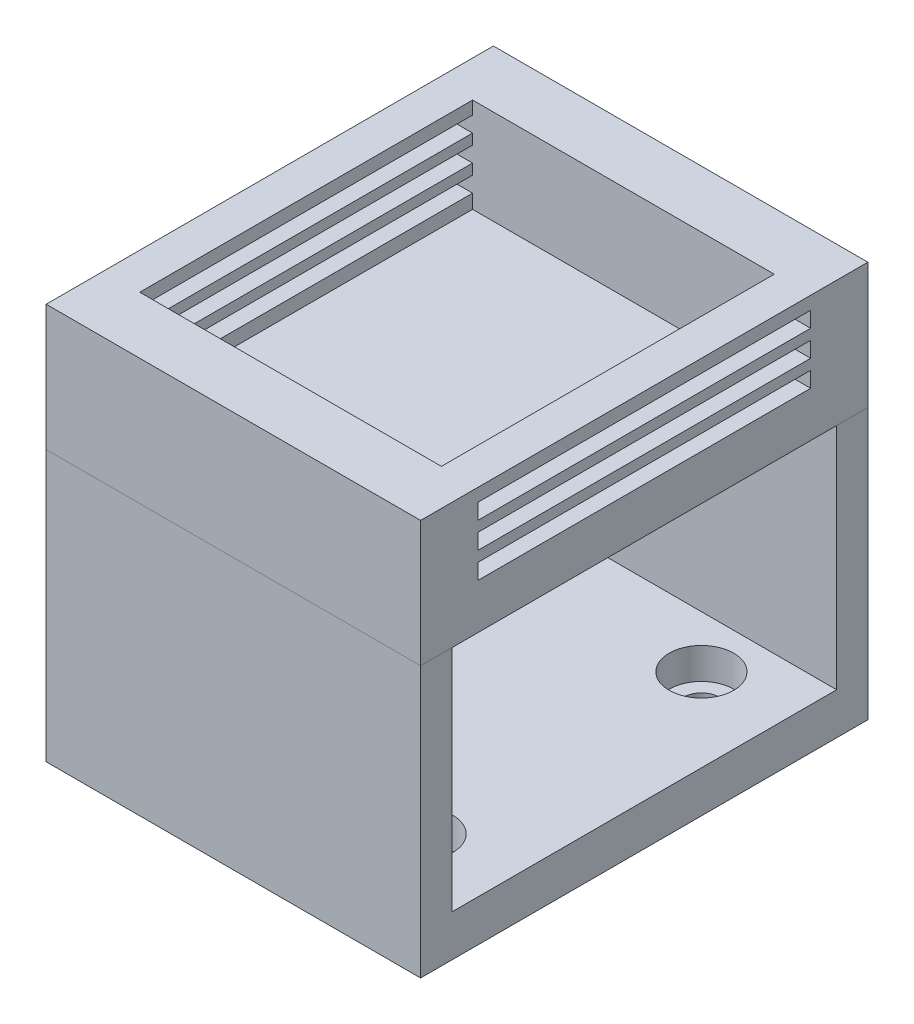
from build123d import *

# Parameters (mm, degrees)
CROQUIS1_W                 = 36
CROQUIS1_H                 = 43
SALIENTE_EXTRUIR4_DEPTH    = 4
CROQUIS6_W                 = 36
CROQUIS6_H                 = 3
SALIENTE_EXTRUIR5_DEPTH    = 22
CROQUIS7_W                 = 36
CROQUIS7_H                 = 43
SALIENTE_EXTRUIR6_DEPTH    = 3
CROQUIS8_W                 = 3
CROQUIS8_H                 = 43
SALIENTE_EXTRUIR7_DEPTH    = 4
CROQUIS9_W                 = 36
CROQUIS9_H                 = 43
CROQUIS9_W_2               = 29
CROQUIS9_H_2               = 32
SALIENTE_EXTRUIR8_DEPTH    = 9.1
CORTAR_EXTRUIR1_DEPTH      = 67.00651483
CORTAR_EXTRUIR1_DEPTH_BACK = 67.00651483
CROQUIS10_W                = 32
CROQUIS10_H                = 1.5
CROQUIS12_R                = 1.75
CORTAR_EXTRUIR2_DEPTH      = 66.633908919
CROQUIS13_R                = 3.1
CORTAR_EXTRUIR3_DEPTH      = 3


# Read off the part's stored shape, not the designer's step: Partir1
with BuildPart() as part:
    # Croquis1 → Saliente-Extruir4 (new body)
    with BuildSketch(Plane(origin=(0, 0, 0), x_dir=(1, 0, 0), z_dir=(0, 1, 0))):
        with Locations((18, 21.5)):
            Rectangle(CROQUIS1_W, CROQUIS1_H)
    extrude(amount=SALIENTE_EXTRUIR4_DEPTH)

    # Croquis6 → Saliente-Extruir5 (add)
    with BuildSketch(Plane(origin=(0, 4, 0), x_dir=(1, 0, 0), z_dir=(0, 1, 0))):
        with Locations((18, 41.5)):
            Rectangle(CROQUIS6_W, CROQUIS6_H)
        with Locations((18, 1.5)):
            Rectangle(CROQUIS6_W, CROQUIS6_H)
    extrude(amount=SALIENTE_EXTRUIR5_DEPTH)

    # Croquis7 → Saliente-Extruir6 (add)
    with BuildSketch(Plane(origin=(0, 26, 0), x_dir=(1, 0, 0), z_dir=(0, 1, 0))):
        with Locations((18, 21.5)):
            Rectangle(CROQUIS7_W, CROQUIS7_H)
    extrude(amount=SALIENTE_EXTRUIR6_DEPTH)

    # Croquis8 → Saliente-Extruir7 (add)
    with BuildSketch(Plane(origin=(0, 4, 0), x_dir=(1, 0, 0), z_dir=(0, 1, 0))):
        with Locations((1.5, 21.5)):
            Rectangle(CROQUIS8_W, CROQUIS8_H)
    extrude(amount=SALIENTE_EXTRUIR7_DEPTH)

    # Croquis9 → Saliente-Extruir8 (add)
    with BuildSketch(Plane(origin=(0, 29, 0), x_dir=(1, 0, 0), z_dir=(0, 1, 0))):
        with Locations((18, 21.5)):
            Rectangle(CROQUIS9_W, CROQUIS9_H)
        with Locations((18, 21.5)):
            Rectangle(CROQUIS9_W_2, CROQUIS9_H_2, mode=Mode.SUBTRACT)
    extrude(amount=SALIENTE_EXTRUIR8_DEPTH)

    # Croquis10 → Cortar-Extruir1 (cut, two sides: drawn at the far end of the back side and taken through both)
    with BuildSketch(Plane(origin=(3.5, 0, 0), x_dir=(0, 0, -1), z_dir=(1, 0, 0)).offset(-CORTAR_EXTRUIR1_DEPTH_BACK)):
        with Locations((21.5, 36.1)):
            Rectangle(CROQUIS10_W, CROQUIS10_H)
        with Locations((21.5, 33.6)):
            Rectangle(CROQUIS10_W, CROQUIS10_H)
        with Locations((21.5, 31.1)):
            Rectangle(CROQUIS10_W, CROQUIS10_H)
    extrude(amount=CORTAR_EXTRUIR1_DEPTH + CORTAR_EXTRUIR1_DEPTH_BACK, mode=Mode.SUBTRACT)

    # Croquis12 → Cortar-Extruir2 (cut, through all)
    with BuildSketch(Plane(origin=(0, 4, 0), x_dir=(1, 0, 0), z_dir=(0, 1, 0))):
        with Locations(Location((8, 35, 0), (0, 0, 270))):
            Circle(CROQUIS12_R)
        with Locations(Location((28, 35, 0), (0, 0, 270))):
            Circle(CROQUIS12_R)
        with Locations(Location((8, 8, 0), (0, 0, 270))):
            Circle(CROQUIS12_R)
        with Locations(Location((28, 8, 0), (0, 0, 270))):
            Circle(CROQUIS12_R)
    extrude(amount=-CORTAR_EXTRUIR2_DEPTH, mode=Mode.SUBTRACT)

    # Croquis13 → Cortar-Extruir3 (cut)
    with BuildSketch(Plane(origin=(0, 4, 0), x_dir=(1, 0, 0), z_dir=(0, 1, 0))):
        with Locations(Location((8, 35, 0), (0, 0, 270))):
            Circle(CROQUIS13_R)
        with Locations(Location((28, 35, 0), (0, 0, 270))):
            Circle(CROQUIS13_R)
        with Locations(Location((28, 8, 0), (0, 0, 270))):
            Circle(CROQUIS13_R)
        with Locations(Location((8, 8, 0), (0, 0, 270))):
            Circle(CROQUIS13_R)
    extrude(amount=-CORTAR_EXTRUIR3_DEPTH, mode=Mode.SUBTRACT)


with BuildPart() as body_2:
    # Partir1: the piece on the far side of the plane
    add(part.part)
    split(bisect_by=Plane(origin=(0, 26, 0), x_dir=(1, 0, 0), z_dir=(0, 1, 0)), keep=Keep.BOTTOM)


with BuildPart() as part_1:
    add(part.part)

    # Partir1
    split(bisect_by=Plane(origin=(0, 26, 0), x_dir=(1, 0, 0), z_dir=(0, 1, 0)), keep=Keep.TOP)


solid = Compound([body_2.part, part_1.part])
